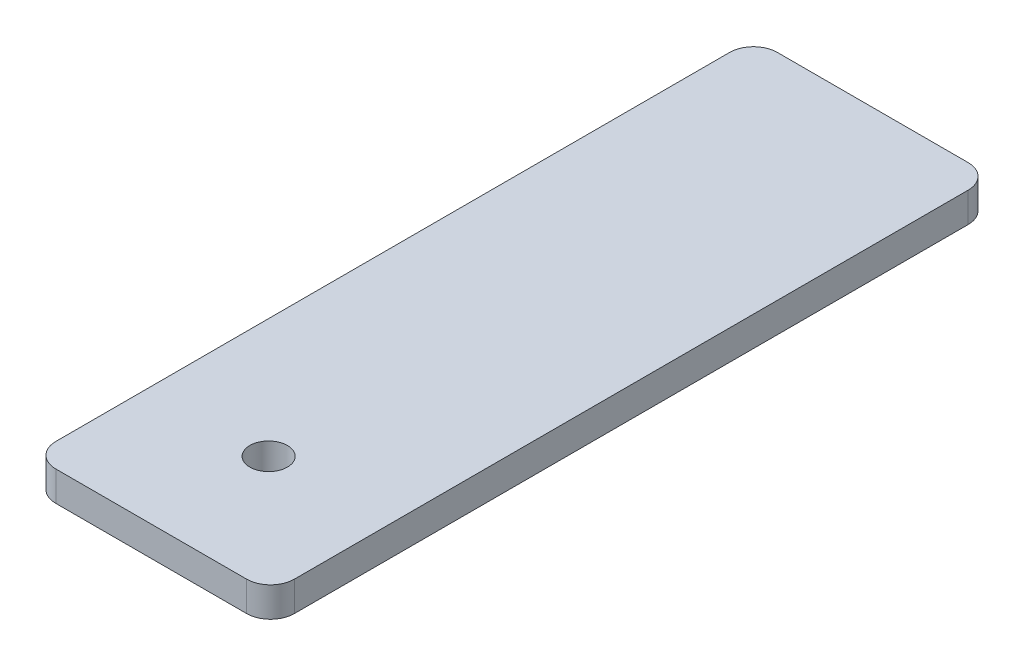
from build123d import *

# Parameters (mm, degrees)
SKETCH1_W           = 25.4
SKETCH1_H           = 76.825
BOSS_EXTRUDE1_DEPTH = 3.175
SKETCH2_R           = 2
CUT_EXTRUDE1_DEPTH  = 63.137257853
FILLET1_R           = 2.54


with BuildPart() as part:
    # Sketch1 → Boss-Extrude1 (new body)
    with BuildSketch(Plane(origin=(0, 0, 0), x_dir=(1, 0, 0), z_dir=(0, 1, 0))):
        with Locations((-13.581081081, 17.803716216)):
            Rectangle(SKETCH1_W, SKETCH1_H)
    extrude(amount=BOSS_EXTRUDE1_DEPTH)

    # Sketch2 → Cut-Extrude1 (cut, through all)
    with BuildSketch(Plane(origin=(0, 3.175, 0), x_dir=(1, 0, 0), z_dir=(0, 1, 0))):
        with Locations((-13.581081081, -8.108783784)):
            Circle(SKETCH2_R)
    extrude(amount=-CUT_EXTRUDE1_DEPTH, mode=Mode.SUBTRACT)

    # Fillet1
    fillet1_edges = [part.edges().sort_by_distance(p)[0] for p in [
        (-26.281081081, 1.5875, -56.216216216),
        (-0.881081081, 1.5875, -56.216216216),
        (-0.881081081, 1.5875, 20.608783784),
        (-26.281081081, 1.5875, 20.608783784),
    ]]
    fillet(fillet1_edges, radius=FILLET1_R)


solid = part.part
